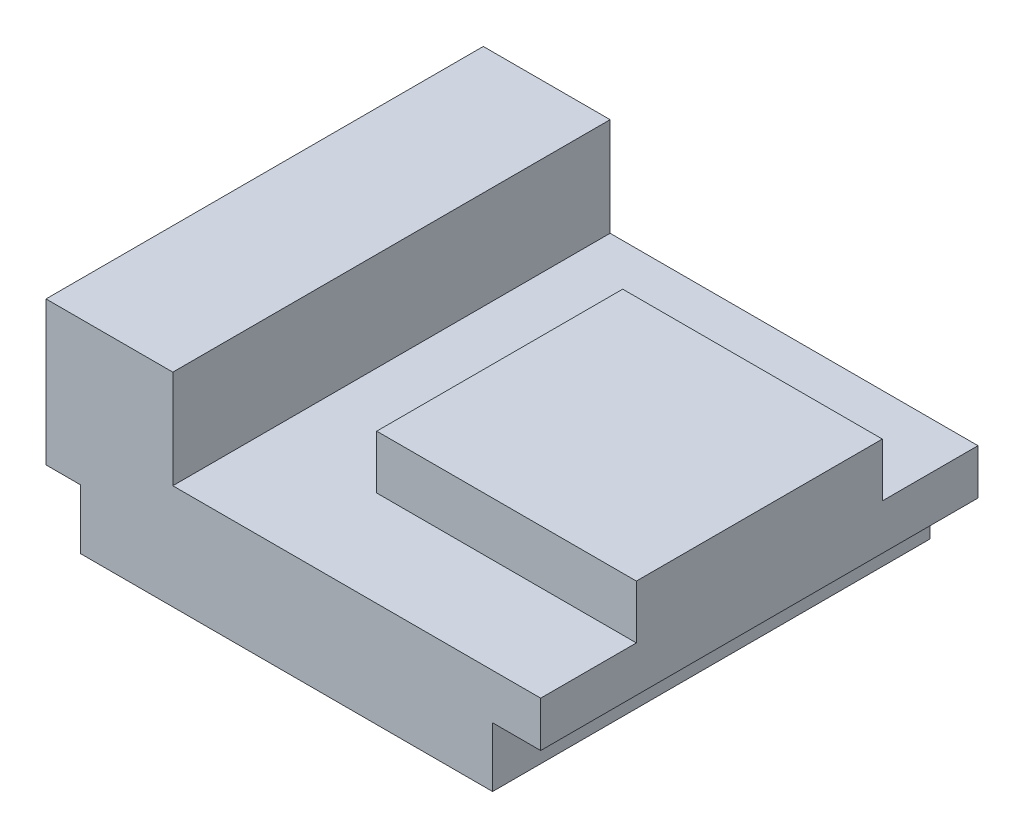
from build123d import *

# Parameters (mm, degrees)
SKETCH_1_W      = 18.1
SKETCH_1_H      = 16
EXTRUDE_1_DEPTH = 1.66
SKETCH_2_W      = 15.08
SKETCH_2_H      = 16
EXTRUDE_2_DEPTH = 2.18
SKETCH_3_W      = 9.5
SKETCH_3_H      = 9
EXTRUDE_3_DEPTH = 1.96
SKETCH_4_W      = 4.64
SKETCH_4_H      = 16
EXTRUDE_4_DEPTH = 3.6
SKETCH_5_R      = 1.5
EXTRUDE_5_DEPTH = 0.3
CHAMFER_1_SIZE  = 0.3


with BuildPart() as part:
    # 草图1 → 凸台-拉伸1 (new body)
    with BuildSketch(Plane(origin=(0, 0, 0), x_dir=(1, 0, 0), z_dir=(0, 1, 0))):
        with Locations((9.05, 8)):
            Rectangle(SKETCH_1_W, SKETCH_1_H)
    extrude(amount=EXTRUDE_1_DEPTH)

    # 草图2 → 凸台-拉伸2 (add)
    with BuildSketch(Plane.XZ):
        with Locations((8.8, -8)):
            Rectangle(SKETCH_2_W, SKETCH_2_H)
    extrude(amount=EXTRUDE_2_DEPTH)

    # 草图3 → 凸台-拉伸3 (add)
    with BuildSketch(Plane(origin=(0, 1.66, 0), x_dir=(1, 0, 0), z_dir=(0, 1, 0))):
        with Locations((13.35, 8)):
            Rectangle(SKETCH_3_W, SKETCH_3_H)
    extrude(amount=EXTRUDE_3_DEPTH)

    # 草图4 → 凸台-拉伸4 (add)
    with BuildSketch(Plane(origin=(0, 1.66, 0), x_dir=(1, 0, 0), z_dir=(0, 1, 0))):
        with Locations((2.32, 8)):
            Rectangle(SKETCH_4_W, SKETCH_4_H)
    extrude(amount=EXTRUDE_4_DEPTH)

    # 草图5 → 凸台-拉伸5 (add)
    with BuildSketch(Plane.XZ.offset(2.18)):
        with Locations(Location((8.26, -8, 0), (0, 0, 270))):
            Circle(SKETCH_5_R)
    extrude(amount=EXTRUDE_5_DEPTH)

    # 倒角1
    chamfer_1_edges = [part.edges().sort_by_distance(p)[0] for p in [
        (8.26, -2.18, -6.5),
    ]]
    chamfer(chamfer_1_edges, length=CHAMFER_1_SIZE - 0.0001)  # a hair under: the kernel refuses the full size


solid = part.part
